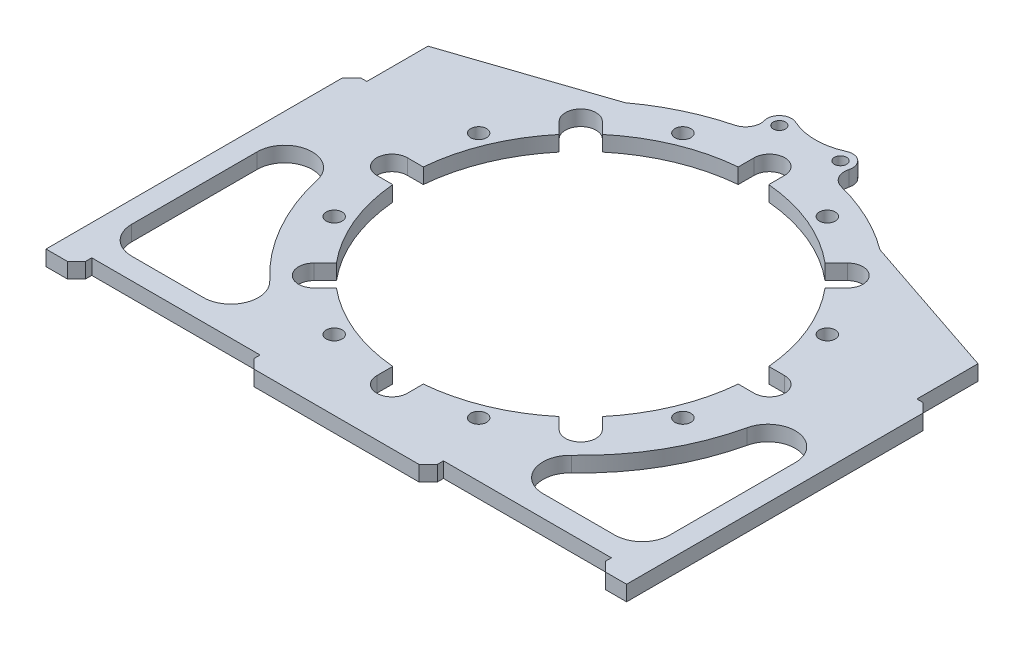
from build123d import *

# Parameters (mm, degrees)
SZKIC1_R                    = 2.6
SZKIC1_R_2                  = 2
DODANIE_WYCI_GNI_CIE1_DEPTH = 5


with BuildPart() as part:
    # Szkic1 → Dodanie-wyciągnięcie1 (new body)
    with BuildSketch(Plane(origin=(0, 0, 0), x_dir=(1, 0, 0), z_dir=(0, 1, 0))):
        with BuildLine():
            Line((94.999977567, -79.999143019), (94.999977567, 17))
            Line((94.999977567, 17), (91.999977567, 20))
            Line((91.999977567, 20), (89.999977567, 20))
            Line((89.999977567, 20), (89.999977567, 40))
            Line((89.999977567, 40), (41.665725752, 56.24915375))
            ThreePointArc((41.665725752, 56.24915375), (30.110393843, 63.193070685), (17.43825097, 67.793122093))
            ThreePointArc((17.43825097, 67.793122093), (14.361214726, 70.122539902), (13.859484589, 73.949105758))
            ThreePointArc((13.859484589, 73.949105758), (12.587356431, 78.050505974), (8.333333333, 78.636237372))
            ThreePointArc((8.333333333, 78.636237372), (0, 76.817424229), (-8.333333333, 78.636237372))
            ThreePointArc((-8.333333333, 78.636237372), (-12.587356431, 78.050505974), (-13.859484589, 73.949105758))
            ThreePointArc((-13.859484589, 73.949105758), (-14.361214726, 70.122539902), (-17.43825097, 67.793122093))
            ThreePointArc((-17.43825097, 67.793122093), (-30.110393843, 63.193070685), (-41.665725752, 56.24915375))
            Line((-41.665725752, 56.24915375), (-90.000022433, 40))
            Line((-90.000022433, 40), (-90.000022433, 20))
            Line((-90.000022433, 20), (-92.000022433, 20))
            Line((-92.000022433, 20), (-95.000022433, 17))
            Line((-95.000022433, 17), (-95.000022433, -80))
            Line((-95.000022433, -80), (-88.029159795, -80))
            Line((-88.029159795, -80), (-85.029159795, -77))
            Line((-85.029159795, -77), (-85.029159795, -74.999011692))
            Line((-85.029159795, -74.999011692), (-29.934557629, -74.998286038))
            Line((-29.934557629, -74.998286038), (-29.934557629, -77))
            Line((-29.934557629, -77), (-26.934557629, -80))
            Line((-26.934557629, -80), (27.065442371, -80))
            Line((27.065442371, -80), (30.065442371, -77))
            Line((30.065442371, -77), (30.065442371, -74.999143019))
            Line((30.065442371, -74.999143019), (85.029114929, -74.999143019))
            Line((85.029114929, -74.999143019), (85.029114929, -76.999143019))
            Line((85.029114929, -76.999143019), (88.029114929, -79.999143019))
            Line((88.029114929, -79.999143019), (94.999977567, -79.999143019))
        make_face()
        with Locations((-23.630701949, -57.049561133)):
            Circle(SZKIC1_R, mode=Mode.SUBTRACT)
        with Locations((57.049561133, -23.630701949)):
            Circle(SZKIC1_R, mode=Mode.SUBTRACT)
        with Locations((57.049561133, 23.630701949)):
            Circle(SZKIC1_R, mode=Mode.SUBTRACT)
        with Locations((-57.049561133, 23.630701949)):
            Circle(SZKIC1_R, mode=Mode.SUBTRACT)
        with Locations((-57.049561133, -23.630701949)):
            Circle(SZKIC1_R, mode=Mode.SUBTRACT)
        with Locations((23.630701949, 57.049561133)):
            Circle(SZKIC1_R, mode=Mode.SUBTRACT)
        with Locations((-23.630701949, 57.049561133)):
            Circle(SZKIC1_R, mode=Mode.SUBTRACT)
        with Locations((23.630701949, -57.049561133)):
            Circle(SZKIC1_R, mode=Mode.SUBTRACT)
        with Locations((-10, 75)):
            Circle(SZKIC1_R_2, mode=Mode.SUBTRACT)
        with Locations((10, 75)):
            Circle(SZKIC1_R_2, mode=Mode.SUBTRACT)
        with BuildLine():
            Line((-47.199377644, -40.128309832), (-43.507789909, -36.436722097))
            ThreePointArc((-43.507789909, -36.436722097), (-52.43016347, -21.717284787), (-56.529306559, -5))
            Line((-56.529306559, -5), (-61.75, -5))
            ThreePointArc((-61.75, -5), (-66.749997865, 0), (-61.75, 5))
            Line((-61.75, 5), (-56.529306559, 5))
            ThreePointArc((-56.529306559, 5), (-52.43016347, 21.717284787), (-43.507789909, 36.436722097))
            Line((-43.507789909, 36.436722097), (-47.199377644, 40.128309832))
            ThreePointArc((-47.199377644, 40.128309832), (-47.199379095, 47.199379095), (-40.128309832, 47.199377644))
            Line((-40.128309832, 47.199377644), (-36.436722097, 43.507789909))
            ThreePointArc((-36.436722097, 43.507789909), (-21.717284787, 52.43016347), (-5, 56.529306559))
            Line((-5, 56.529306559), (-5, 61.75))
            ThreePointArc((-5, 61.75), (0, 66.75), (5, 61.75))
            Line((5, 61.75), (5, 56.529306559))
            ThreePointArc((5, 56.529306559), (21.717284787, 52.43016347), (36.436722097, 43.507789909))
            Line((36.436722097, 43.507789909), (40.128309832, 47.199377644))
            ThreePointArc((40.128309832, 47.199377644), (47.199377644, 47.199377644), (47.199377644, 40.128309832))
            Line((47.199377644, 40.128309832), (43.507789909, 36.436722097))
            ThreePointArc((43.507789909, 36.436722097), (52.43016347, 21.717284787), (56.529306559, 5))
            Line((56.529306559, 5), (61.75, 5))
            ThreePointArc((61.75, 5), (66.75, 0), (61.75, -5))
            Line((61.75, -5), (56.529306559, -5))
            ThreePointArc((56.529306559, -5), (52.43016347, -21.717284787), (43.507789909, -36.436722097))
            Line((43.507789909, -36.436722097), (47.199377644, -40.128309832))
            ThreePointArc((47.199377644, -40.128309832), (47.199377644, -47.199377644), (40.128309832, -47.199377644))
            Line((40.128309832, -47.199377644), (36.436722097, -43.507789909))
            ThreePointArc((36.436722097, -43.507789909), (21.717284787, -52.43016347), (5, -56.529306559))
            Line((5, -56.529306559), (5, -61.75))
            ThreePointArc((5, -61.75), (0, -66.75), (-5, -61.75))
            Line((-5, -61.75), (-5, -56.529306559))
            ThreePointArc((-5, -56.529306559), (-21.717284787, -52.43016347), (-36.436722097, -43.507789909))
            Line((-36.436722097, -43.507789909), (-40.128309832, -47.199377644))
            ThreePointArc((-40.128309832, -47.199377644), (-47.199377644, -47.199377644), (-47.199377644, -40.128309832))
        make_face(mode=Mode.SUBTRACT)
        with BuildLine():
            Line((55.629683101, -67.999011692), (79.130907175, -67.999011692))
            ThreePointArc((79.130907175, -67.999011692), (85.494868205, -65.362972723), (88.130907175, -58.999011692))
            Line((88.130907175, -58.999011692), (88.130907175, -17.88844475))
            ThreePointArc((88.130907175, -17.88844475), (80.130901566, -8.944172213), (70.353126904, -15.900839777))
            ThreePointArc((70.353126904, -15.900839777), (62.638186453, -35.732859287), (49.46314995, -52.443565948))
            ThreePointArc((49.46314995, -52.443565948), (47.263112367, -62.315710978), (55.629683101, -67.999011692))
        make_face(mode=Mode.SUBTRACT)
        with BuildLine():
            Line((-55.49879836, -67.999011692), (-79.000022433, -67.999011692))
            ThreePointArc((-79.000022433, -67.999011692), (-85.363983464, -65.362972723), (-88.000022433, -58.999011692))
            Line((-88.000022433, -58.999011692), (-88.000022433, -17.88844475))
            ThreePointArc((-88.000022433, -17.88844475), (-80.000016825, -8.944172213), (-70.222242163, -15.900839777))
            ThreePointArc((-70.222242163, -15.900839777), (-62.507301711, -35.732859287), (-49.332265209, -52.443565948))
            ThreePointArc((-49.332265209, -52.443565948), (-47.132227626, -62.315710978), (-55.49879836, -67.999011692))
        make_face(mode=Mode.SUBTRACT)
    extrude(amount=DODANIE_WYCI_GNI_CIE1_DEPTH)


solid = part.part
